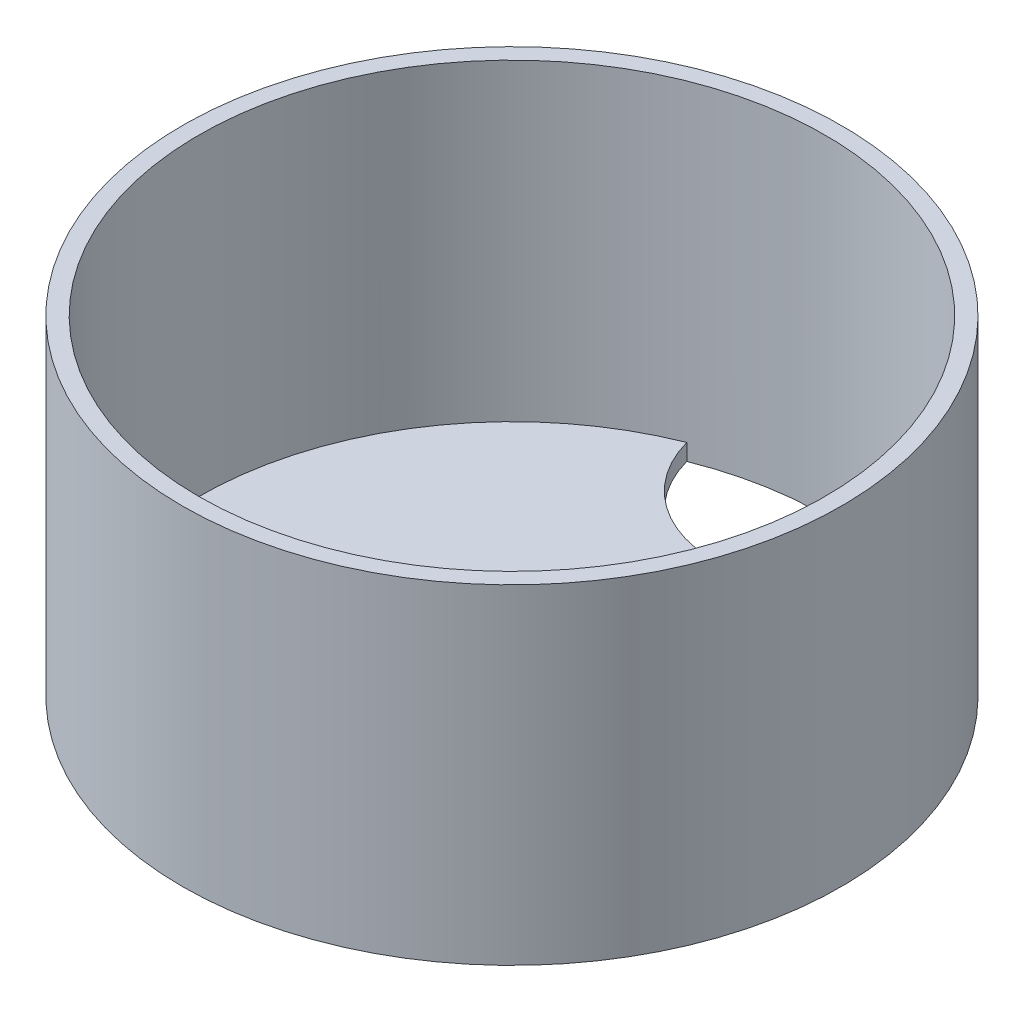
from build123d import *

# Parameters (mm, degrees)
SKETCH1_R           = 40
BOSS_EXTRUDE1_DEPTH = 40
SKETCH2_R           = 38
CUT_EXTRUDE1_DEPTH  = 38
CUT_EXTRUDE2_DEPTH  = 38
SKETCH4_R           = 5
CUT_EXTRUDE3_DEPTH  = 38


with BuildPart() as part:
    # Sketch1 → Boss-Extrude1 (new body)
    with BuildSketch(Plane(origin=(0, 0, 0), x_dir=(1, 0, 0), z_dir=(0, 1, 0))):
        Circle(SKETCH1_R)
    extrude(amount=BOSS_EXTRUDE1_DEPTH)

    # Sketch2 → Cut-Extrude1 (cut)
    with BuildSketch(Plane(origin=(0, 40, 0), x_dir=(1, 0, 0), z_dir=(0, 1, 0))):
        Circle(SKETCH2_R)
    extrude(amount=-CUT_EXTRUDE1_DEPTH, mode=Mode.SUBTRACT)

    # Sketch3 → Cut-Extrude2 (cut)
    with BuildSketch(Plane(origin=(0, 2, 0), x_dir=(1, 0, 0), z_dir=(0, 1, 0))):
        with BuildLine():
            ThreePointArc((-14.076066703, 35.296803626), (0, 24.534862453), (14.076066703, 35.296803626))
            ThreePointArc((14.076066703, 35.296803626), (0, 38), (-14.076066703, 35.296803626))
        make_face()
    extrude(amount=-CUT_EXTRUDE2_DEPTH, mode=Mode.SUBTRACT)

    # Sketch4 → Cut-Extrude3 (cut)
    with BuildSketch(Plane(origin=(0, 2, 0), x_dir=(1, 0, 0), z_dir=(0, 1, 0))):
        Circle(SKETCH4_R)
    extrude(amount=-CUT_EXTRUDE3_DEPTH, mode=Mode.SUBTRACT)


solid = part.part
